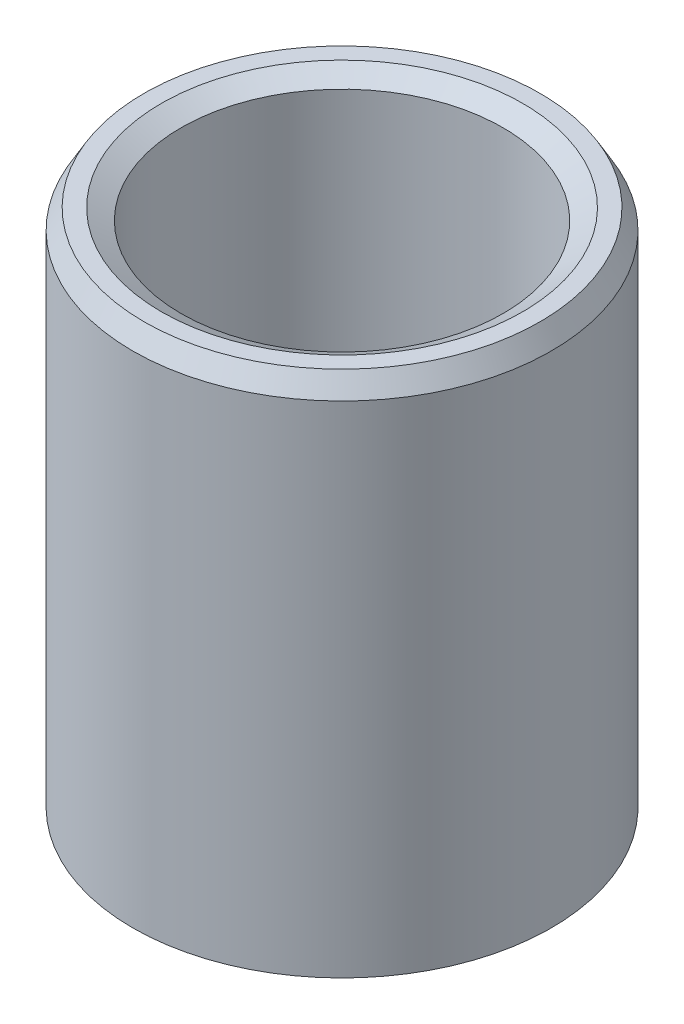
from build123d import *
from OCP.BRepFilletAPI import BRepFilletAPI_MakeChamfer

# Parameters (mm, degrees)
SKETCH1_R           = 42.5
BOSS_EXTRUDE1_DEPTH = 107.750585728
SKETCH2_R           = 32.697800567
CUT_EXTRUDE1_DEPTH  = 124.380260677
CHAMFER1_SIZE       = 3.98235873
CHAMFER1_SIZE2      = 2.299215885


with BuildPart() as part:
    # Sketch1 → Boss-Extrude1 (new body)
    with BuildSketch(Plane(origin=(0, 0, 0), x_dir=(1, 0, 0), z_dir=(0, 1, 0))):
        Circle(SKETCH1_R)
    extrude(amount=BOSS_EXTRUDE1_DEPTH)

    # Sketch2 → Cut-Extrude1 (cut, through all)
    with BuildSketch(Plane(origin=(0, 0, 0), x_dir=(1, 0, 0), z_dir=(0, 1, 0))):
        Circle(SKETCH2_R)
    extrude(amount=CUT_EXTRUDE1_DEPTH, mode=Mode.SUBTRACT)

    # Chamfer1: one chamfer whose edges measure the first distance from different faces: ONE call of the kernel's chamfer builder (chamfer() names one face for all edges)
    chamfer1_edges_1 = [part.edges().sort_by_distance(p)[0] for p in [
        (-32.697800567, 107.750585728, 0),
    ]]
    chamfer1_side_1 = [part.faces().sort_by_distance(p)[0] for p in [
        (-41.297918472, 107.750585728, 0),
    ]]
    chamfer1_edges_2 = [part.edges().sort_by_distance(p)[0] for p in [
        (-32.697800567, 0, 0),
    ]]
    chamfer1_side_2 = [part.faces().sort_by_distance(p)[0] for p in [
        (-32.697800567, 53.875292864, 0),
    ]]
    chamfer1_edges_3 = [part.edges().sort_by_distance(p)[0] for p in [
        (-42.5, 0, 0),
    ]]
    chamfer1_side_3 = [part.faces().sort_by_distance(p)[0] for p in [
        (-41.297918472, 0, 0),
    ]]
    chamfer1_edges_4 = [part.edges().sort_by_distance(p)[0] for p in [
        (-42.5, 107.750585728, 0),
    ]]
    chamfer1_side_4 = [part.faces().sort_by_distance(p)[0] for p in [
        (-42.5, 53.875292864, 0),
    ]]
    chamfer1 = BRepFilletAPI_MakeChamfer(part.part.solid().wrapped)
    for e in chamfer1_edges_1:
        chamfer1.Add(CHAMFER1_SIZE, CHAMFER1_SIZE2, e.wrapped, chamfer1_side_1[0].wrapped)  # the first distance lies on this face
    for e in chamfer1_edges_2:
        chamfer1.Add(CHAMFER1_SIZE, CHAMFER1_SIZE2, e.wrapped, chamfer1_side_2[0].wrapped)  # the first distance lies on this face
    for e in chamfer1_edges_3:
        chamfer1.Add(CHAMFER1_SIZE, CHAMFER1_SIZE2, e.wrapped, chamfer1_side_3[0].wrapped)  # the first distance lies on this face
    for e in chamfer1_edges_4:
        chamfer1.Add(CHAMFER1_SIZE, CHAMFER1_SIZE2, e.wrapped, chamfer1_side_4[0].wrapped)  # the first distance lies on this face
    add(Compound.cast(chamfer1.Shape()), mode=Mode.REPLACE)


solid = part.part
